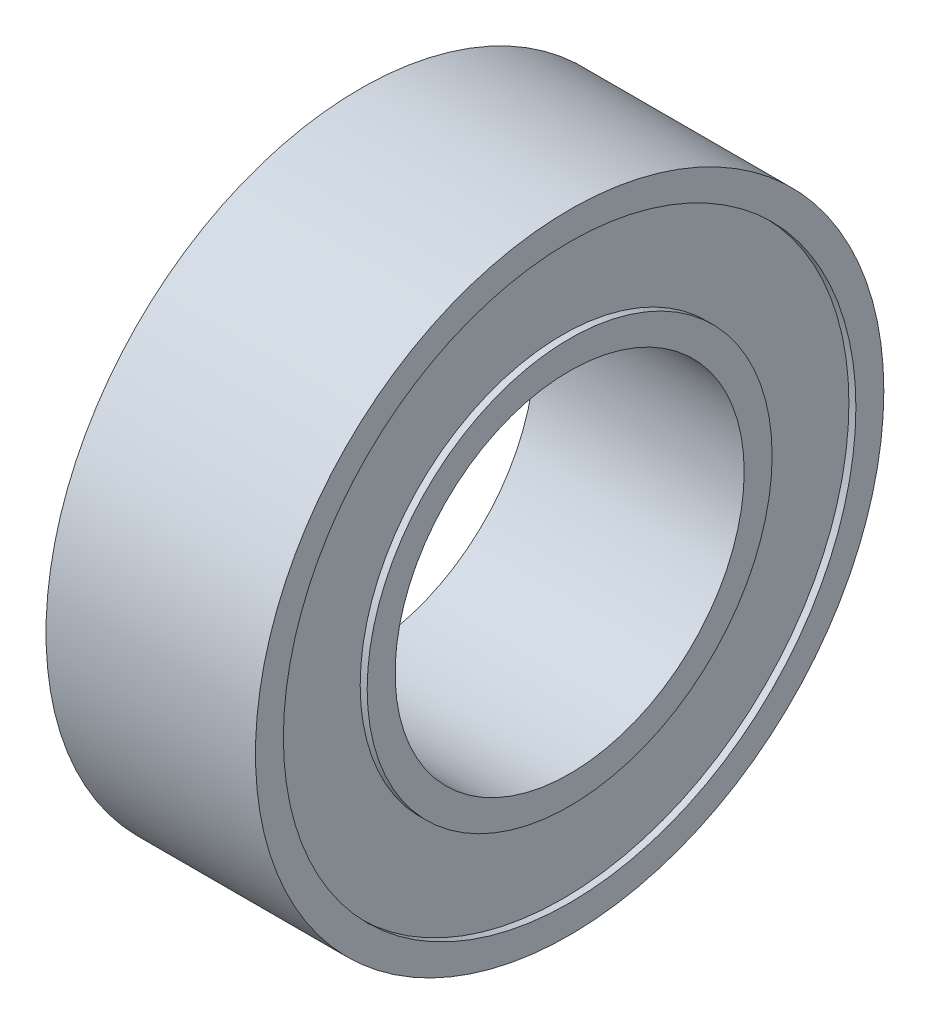
from build123d import *

# Parameters (mm, degrees)
SKETCH1_R           = 4.5
SKETCH1_R_2         = 2.5
BOSS_EXTRUDE1_DEPTH = 3
SKETCH2_R           = 4.1
SKETCH2_R_2         = 2.9
CUT_EXTRUDE1_DEPTH  = 0.1
CUT_EXTRUDE2_START  = -0.1
SKETCH3_R           = 4.1
SKETCH3_R_2         = 2.9
CUT_EXTRUDE2_DEPTH  = 0.1


with BuildPart() as part:
    # Sketch1 → Boss-Extrude1 (new body)
    with BuildSketch(Plane(origin=(0, 0, 0), x_dir=(0, 0, -1), z_dir=(1, 0, 0))):
        Circle(SKETCH1_R)
        Circle(SKETCH1_R_2, mode=Mode.SUBTRACT)
    extrude(amount=BOSS_EXTRUDE1_DEPTH)

    # Sketch2 → Cut-Extrude1 (cut)
    with BuildSketch(Plane(origin=(3, 0, 0), x_dir=(0, 0, -1), z_dir=(1, 0, 0))):
        Circle(SKETCH2_R)
        Circle(SKETCH2_R_2, mode=Mode.SUBTRACT)
    extrude(amount=-CUT_EXTRUDE1_DEPTH, mode=Mode.SUBTRACT)

    # Sketch3 → Cut-Extrude2 (cut)
    with BuildSketch(Plane.ZY.offset(CUT_EXTRUDE2_START)):
        Circle(SKETCH3_R)
        Circle(SKETCH3_R_2, mode=Mode.SUBTRACT)
    extrude(amount=CUT_EXTRUDE2_DEPTH, mode=Mode.SUBTRACT)


solid = part.part
